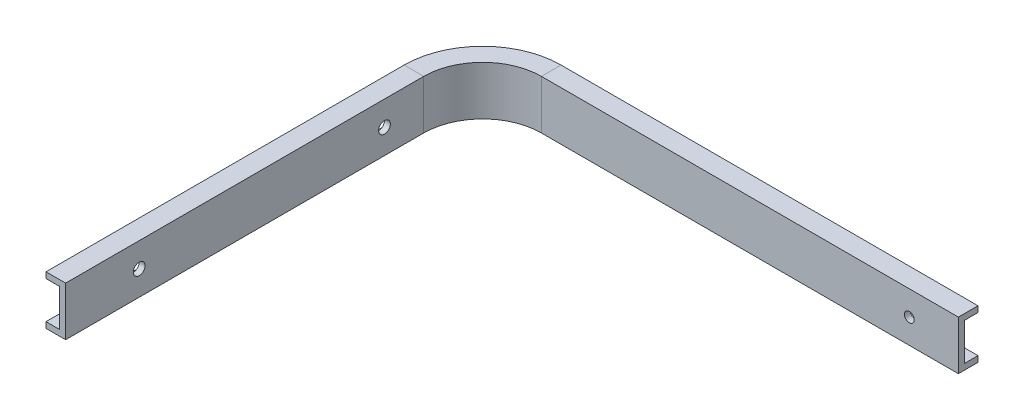
from build123d import *

# Parameters (mm, degrees)
ESQUISSE1_W                  = 450
ESQUISSE1_H                  = 25
EXTRUSION1_DEPTH             = 10
PLIAGE_START                 = -12.5
PLIAGE_1_DEPTH               = 25
PLIAGE_1_2_DEPTH             = 25
ESQUISSE5_R                  = 3
ENL_V_MAT_EXTRU_1_DEPTH      = 330.361564282
ESQUISSE7_R                  = 2.5
ENL_V_MAT_EXTRU_2_DEPTH      = 331.27116136
ENL_V_MAT_EXTRU_3_DEPTH      = 9.5
ENL_V_MAT_EXTRU_3_DEPTH_BACK = 9.5


# Read off the part's stored shape, not the designer's step: Pliage 1
with BuildPart() as part:
    # Esquisse1 → Extrusion1 (new body)
    with BuildSketch(Plane.XY):
        with Locations((-225, 0)):
            Rectangle(ESQUISSE1_W, ESQUISSE1_H)
    extrude(amount=EXTRUSION1_DEPTH)

    # Pliage 1 outline → Pliage 1 (cut)
    with BuildSketch(Plane(origin=(0, 0, 0), x_dir=(1, 0, 0), z_dir=(0, 1, 0)).offset(PLIAGE_START)):
        with BuildLine():
            Line((-450, -10), (-238.968577392, -10))
            ThreePointArc((-238.968577392, -10), (-226.653199905, -2.583426132), (-212.511064281, 0))
            Line((-212.511064281, 0), (-450, 0))
            Line((-450, 0), (-450, -10))
        make_face()
    extrude(amount=PLIAGE_1_DEPTH, mode=Mode.SUBTRACT)

    # Pliage 1 2 outline → Pliage 1 2 (add)
    with BuildSketch(Plane(origin=(0, 0, 0), x_dir=(1, 0, 0), z_dir=(0, 1, 0)).offset(PLIAGE_START)):
        with BuildLine():
            ThreePointArc((-238.968577392, -10), (-248.968577392, -23.542486889), (-252.511064281, -40))
            Line((-252.511064281, -40), (-252.511064281, -222.511064281))
            Line((-252.511064281, -222.511064281), (-242.511064281, -222.511064281))
            Line((-242.511064281, -222.511064281), (-242.511064281, -40))
            ThreePointArc((-242.511064281, -40), (-233.724267717, -18.786796564), (-212.511064281, -10))
            Line((-212.511064281, -10), (-238.968577392, -10))
        make_face()
    extrude(amount=PLIAGE_1_2_DEPTH)

    # Esquisse5 → Enlèv. mat.-Extru.1 (cut, through all)
    with BuildSketch(Plane(origin=(-242.511064281, 0, 0), x_dir=(0, 0, -1), z_dir=(1, 0, 0))):
        with Locations((-185, 0)):
            Circle(ESQUISSE5_R)
        with Locations((-60, 0)):
            Circle(ESQUISSE5_R)
    extrude(amount=-ENL_V_MAT_EXTRU_1_DEPTH, mode=Mode.SUBTRACT)

    # Esquisse7 → Enlèv. mat.-Extru.2 (cut, through all)
    with BuildSketch(Plane.XY.offset(10)):
        with Locations((-25, 0)):
            Circle(ESQUISSE7_R)
    extrude(amount=-ENL_V_MAT_EXTRU_2_DEPTH, mode=Mode.SUBTRACT)

    # Esquisse8 → Enlèv. mat.-Extru.3 (cut, two sides: drawn at the far end of the back side and taken through both)
    with BuildSketch(Plane(origin=(0, 0, 0), x_dir=(1, 0, 0), z_dir=(0, 1, 0)).offset(-ENL_V_MAT_EXTRU_3_DEPTH_BACK)):
        with BuildLine():
            Line((0, -7), (-212.511064281, -7))
            ThreePointArc((-212.511064281, -7), (-235.84558806, -16.665476221), (-245.511064281, -40))
            Line((-245.511064281, -40), (-245.511064281, -222.511064281))
            Line((-245.511064281, -222.511064281), (-252.511064281, -222.511064281))
            Line((-252.511064281, -222.511064281), (-252.511064281, -40))
            ThreePointArc((-252.511064281, -40), (-240.795335529, -11.715728753), (-212.511064281, 0))
            Line((-212.511064281, 0), (0, 0))
            Line((0, 0), (0, -7))
        make_face()
    extrude(amount=ENL_V_MAT_EXTRU_3_DEPTH + ENL_V_MAT_EXTRU_3_DEPTH_BACK, mode=Mode.SUBTRACT)


solid = part.part
